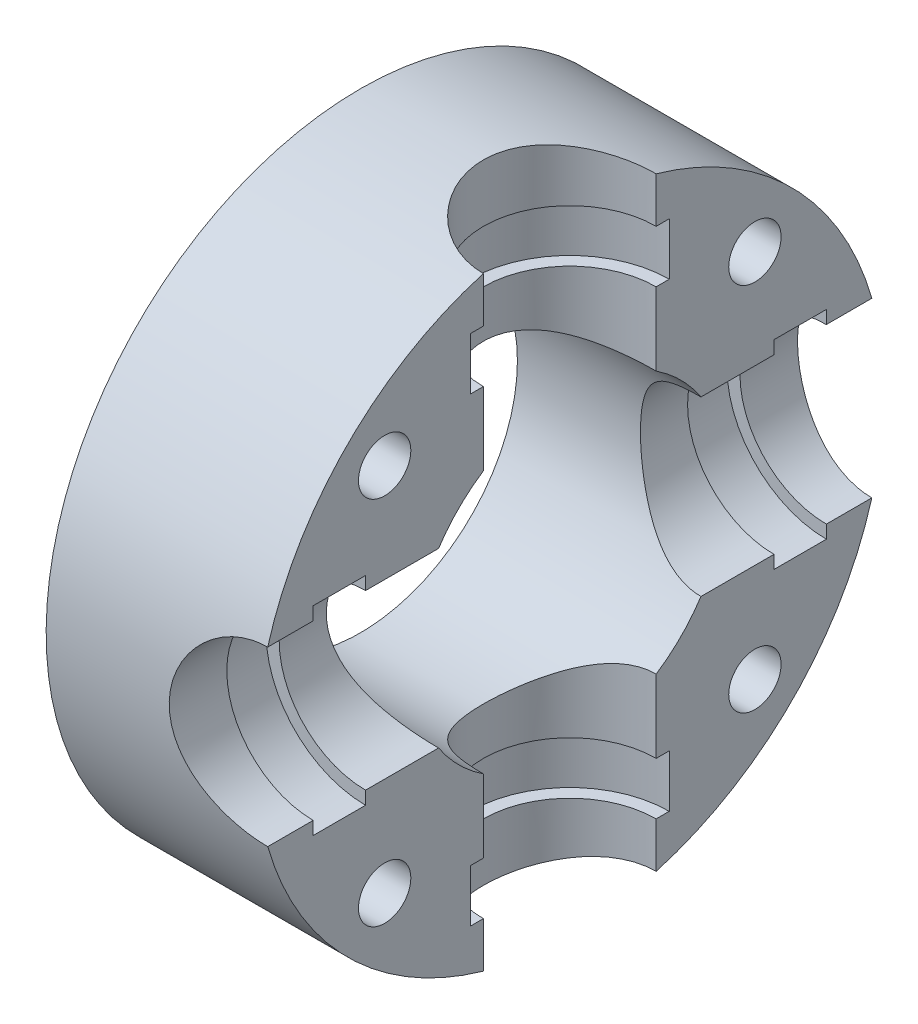
from build123d import *

# Parameters (mm, degrees)
SKETCH1_R           = 30
SKETCH1_R_2         = 15
BOSS_EXTRUDE1_DEPTH = 40
SKETCH3_R           = 9.5
CUT_EXTRUDE1_DEPTH  = 2.5
SKETCH4_R           = 8.25
CUT_EXTRUDE2_DEPTH  = 15
CIRPATTERN1_COUNT   = 4
SKETCH5_R           = 2.5
CUT_EXTRUDE3_DEPTH  = 47.904157769


# Read off the part's stored shape, not the designer's step: Body-Delete/Keep 1
with BuildPart() as part:
    # Sketch1 → Boss-Extrude1 (new body)
    with BuildSketch(Plane(origin=(0, 0, 0), x_dir=(0, 0, -1), z_dir=(1, 0, 0))):
        Circle(SKETCH1_R)
        Circle(SKETCH1_R_2, mode=Mode.SUBTRACT)
    extrude(amount=BOSS_EXTRUDE1_DEPTH)

    # Sketch3 → Cut-Extrude1 (cut, symmetric)
    with BuildSketch(Plane.XY.offset(22)):
        with Locations((20, 0)):
            Circle(SKETCH3_R)
    cut_extrude1 = extrude(amount=CUT_EXTRUDE1_DEPTH, both=True, mode=Mode.SUBTRACT)

    # Sketch4 → Cut-Extrude2 (cut, symmetric)
    with BuildSketch(Plane.XY.offset(22)):
        with Locations((20, 0)):
            Circle(SKETCH4_R)
    cut_extrude2 = extrude(amount=CUT_EXTRUDE2_DEPTH, both=True, mode=Mode.SUBTRACT)

    # CirPattern1: Cut-Extrude1, Cut-Extrude2 ×4 about axis
    cirpattern1_axis = Axis((0, 0, 0), (1, 0, 0))
    add([cut_extrude1.rotate(cirpattern1_axis, i * 360 / CIRPATTERN1_COUNT) for i in range(1, CIRPATTERN1_COUNT)], mode=Mode.SUBTRACT)
    add([cut_extrude2.rotate(cirpattern1_axis, i * 360 / CIRPATTERN1_COUNT) for i in range(1, CIRPATTERN1_COUNT)], mode=Mode.SUBTRACT)


with BuildPart() as body_2:
    # Split1: the piece on the far side of the plane
    add(part.part)
    split(bisect_by=Plane(origin=(20, 0, 0), x_dir=(0, 0, 1), z_dir=(1, 0, 0)), keep=Keep.BOTTOM)

    # Sketch5 → Cut-Extrude3 (cut, through all)
    with BuildSketch(Plane.ZY):
        with Locations((-17.67766953, 17.67766953)):
            Circle(SKETCH5_R)
        with Locations((17.67766953, 17.67766953)):
            Circle(SKETCH5_R)
        with Locations((17.67766953, -17.67766953)):
            Circle(SKETCH5_R)
        with Locations((-17.67766953, -17.67766953)):
            Circle(SKETCH5_R)
    extrude(amount=-CUT_EXTRUDE3_DEPTH, mode=Mode.SUBTRACT)


with BuildPart() as part_1:
    add(part.part)

    # Split1
    split(bisect_by=Plane(origin=(20, 0, 0), x_dir=(0, 0, 1), z_dir=(1, 0, 0)), keep=Keep.TOP)


solid = body_2.part
